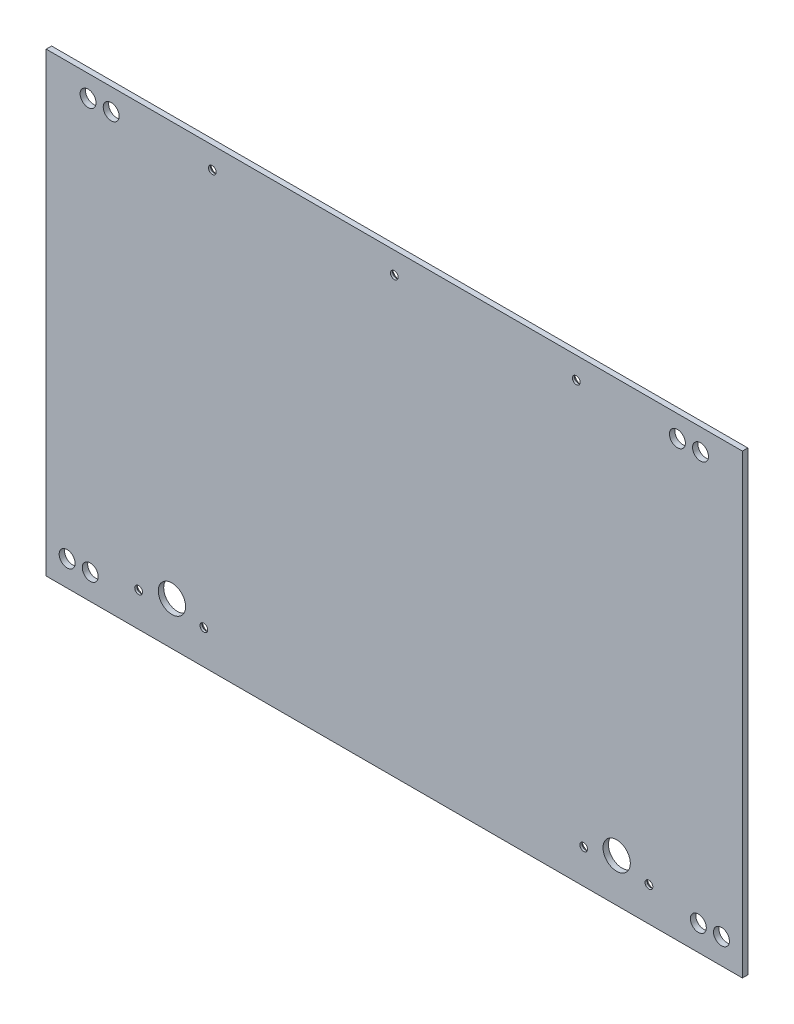
from build123d import *

# Parameters (mm, degrees)
SKETCH1_W                                      = 306.05
SKETCH1_H                                      = 197.425
BOSS_EXTRUDE1_DEPTH                            = 2.38125
SKETCH9_W                                      = 306.05
SKETCH9_H                                      = 2.38125
BOSS_EXTRUDE2_DEPTH                            = 3.175
SKETCH10_R                                     = 3.5
CUT_EXTRUDE1_DEPTH                             = 184.856965146
CSK_FOR_M3_FLAT_HEAD_MACHINE_SCREW1_AT_2_COUNT = 2
CSK_FOR_M3_FLAT_HEAD_MACHINE_SCREW1_AT_2_PITCH = 28.69
CSK_FOR_M3_FLAT_HEAD_MACHINE_SCREW1_AT_3_COUNT = 2
CSK_FOR_M3_FLAT_HEAD_MACHINE_SCREW1_AT_3_PITCH = 178.948509983
CSK_FOR_M3_FLAT_HEAD_MACHINE_SCREW1_AT_4_COUNT = 2
CSK_FOR_M3_FLAT_HEAD_MACHINE_SCREW1_AT_4_PITCH = 208.645558843
CSK_FOR_M3_FLAT_HEAD_MACHINE_SCREW1_AT_5_COUNT = 2
CSK_FOR_M3_FLAT_HEAD_MACHINE_SCREW1_AT_5_PITCH = 260.467597265
CSK_FOR_M3_FLAT_HEAD_MACHINE_SCREW1_AT_6_COUNT = 2
CSK_FOR_M3_FLAT_HEAD_MACHINE_SCREW1_AT_6_PITCH = 224.342
CSK_FOR_M3_FLAT_HEAD_MACHINE_SCREW1_AT_7_COUNT = 2
CSK_FOR_M3_FLAT_HEAD_MACHINE_SCREW1_AT_7_PITCH = 195.652
SKETCH13_R                                     = 6
CUT_EXTRUDE2_DEPTH                             = 184.856965146


with BuildPart() as part:
    # Sketch1 → Boss-Extrude1 (new body)
    with BuildSketch(Plane.XY):
        Rectangle(SKETCH1_W, SKETCH1_H)
    extrude(amount=BOSS_EXTRUDE1_DEPTH)

    # Sketch9 → Boss-Extrude2 (add)
    with BuildSketch(Plane(origin=(0, 98.7125, 0), x_dir=(1, 0, 0), z_dir=(0, 1, 0))):
        with Locations((0, -1.190625)):
            Rectangle(SKETCH9_W, SKETCH9_H)
    extrude(amount=BOSS_EXTRUDE2_DEPTH)

    # Sketch10 → Cut-Extrude1 (cut, through all)
    with BuildSketch(Plane(origin=(0, 0, 0), x_dir=(-1, 0, 0), z_dir=(0, 0, -1))):
        with Locations((-134.610000066, 92.3625)):
            Circle(SKETCH10_R)
        with Locations((-124.450000066, 92.3625)):
            Circle(SKETCH10_R)
        with Locations((-143.817500066, -87.5375001)):
            Circle(SKETCH10_R)
        with Locations((-133.657500066, -87.5375001)):
            Circle(SKETCH10_R)
    cut_extrude1 = extrude(amount=-CUT_EXTRUDE1_DEPTH, mode=Mode.SUBTRACT)

    # Mirror1: Cut-Extrude1 across plane
    add(cut_extrude1.mirror(Plane(origin=(0, 0, 0), x_dir=(0, 0, 1), z_dir=(1, 0, 0))), mode=Mode.SUBTRACT)

    # Sketch12 → CSK for M3 Flat Head Machine Screw1 (revolve, cut)
    with BuildSketch(Plane(origin=(111.94, -83.7125, 0), x_dir=(0, 1, 0), z_dir=(1, 0, 0))):
        Polygon((0, 0), (0, 2.38125), (1.7, 2.38125), (1.7, 1.45), (3.15, 0), align=None)
    csk_for_m3_flat_head_machine_screw1 = revolve(axis=Axis((111.94, -83.7125, -6.35), (0, 0, 1)), mode=Mode.SUBTRACT)

    # CSK for M3 Flat Head Machine Screw1 at 2: CSK for M3 Flat Head Machine Screw1 ×2
    with Locations(*[(-i * CSK_FOR_M3_FLAT_HEAD_MACHINE_SCREW1_AT_2_PITCH, 0, 0) for i in range(1, CSK_FOR_M3_FLAT_HEAD_MACHINE_SCREW1_AT_2_COUNT)]):
        add(csk_for_m3_flat_head_machine_screw1, mode=Mode.SUBTRACT)

    # CSK for M3 Flat Head Machine Screw1 at 3: CSK for M3 Flat Head Machine Screw1 ×2
    with Locations(*[Vector(-0.17848709666869053, 0.9839422525345589, 0) * (i * CSK_FOR_M3_FLAT_HEAD_MACHINE_SCREW1_AT_3_PITCH) for i in range(1, CSK_FOR_M3_FLAT_HEAD_MACHINE_SCREW1_AT_3_COUNT)]):
        add(csk_for_m3_flat_head_machine_screw1, mode=Mode.SUBTRACT)

    # CSK for M3 Flat Head Machine Screw1 at 4: CSK for M3 Flat Head Machine Screw1 ×2
    with Locations(*[Vector(-0.5365079449598512, 0.8438952689729675, 0) * (i * CSK_FOR_M3_FLAT_HEAD_MACHINE_SCREW1_AT_4_PITCH) for i in range(1, CSK_FOR_M3_FLAT_HEAD_MACHINE_SCREW1_AT_4_COUNT)]):
        add(csk_for_m3_flat_head_machine_screw1, mode=Mode.SUBTRACT)

    # CSK for M3 Flat Head Machine Screw1 at 5: CSK for M3 Flat Head Machine Screw1 ×2
    with Locations(*[Vector(-0.7369054808176358, 0.6759957931384847, 0) * (i * CSK_FOR_M3_FLAT_HEAD_MACHINE_SCREW1_AT_5_PITCH) for i in range(1, CSK_FOR_M3_FLAT_HEAD_MACHINE_SCREW1_AT_5_COUNT)]):
        add(csk_for_m3_flat_head_machine_screw1, mode=Mode.SUBTRACT)

    # CSK for M3 Flat Head Machine Screw1 at 6: CSK for M3 Flat Head Machine Screw1 ×2
    with Locations(*[(-i * CSK_FOR_M3_FLAT_HEAD_MACHINE_SCREW1_AT_6_PITCH, 0, 0) for i in range(1, CSK_FOR_M3_FLAT_HEAD_MACHINE_SCREW1_AT_6_COUNT)]):
        add(csk_for_m3_flat_head_machine_screw1, mode=Mode.SUBTRACT)

    # CSK for M3 Flat Head Machine Screw1 at 7: CSK for M3 Flat Head Machine Screw1 ×2
    with Locations(*[(-i * CSK_FOR_M3_FLAT_HEAD_MACHINE_SCREW1_AT_7_PITCH, 0, 0) for i in range(1, CSK_FOR_M3_FLAT_HEAD_MACHINE_SCREW1_AT_7_COUNT)]):
        add(csk_for_m3_flat_head_machine_screw1, mode=Mode.SUBTRACT)

    # Sketch13 → Cut-Extrude2 (cut, through all)
    with BuildSketch(Plane(origin=(0, 0, 0), x_dir=(-1, 0, 0), z_dir=(0, 0, -1))):
        with Locations((-97.75, -79.7125001)):
            Circle(SKETCH13_R)
        with Locations((97.75, -79.7125001)):
            Circle(SKETCH13_R)
    extrude(amount=-CUT_EXTRUDE2_DEPTH, mode=Mode.SUBTRACT)


solid = part.part
